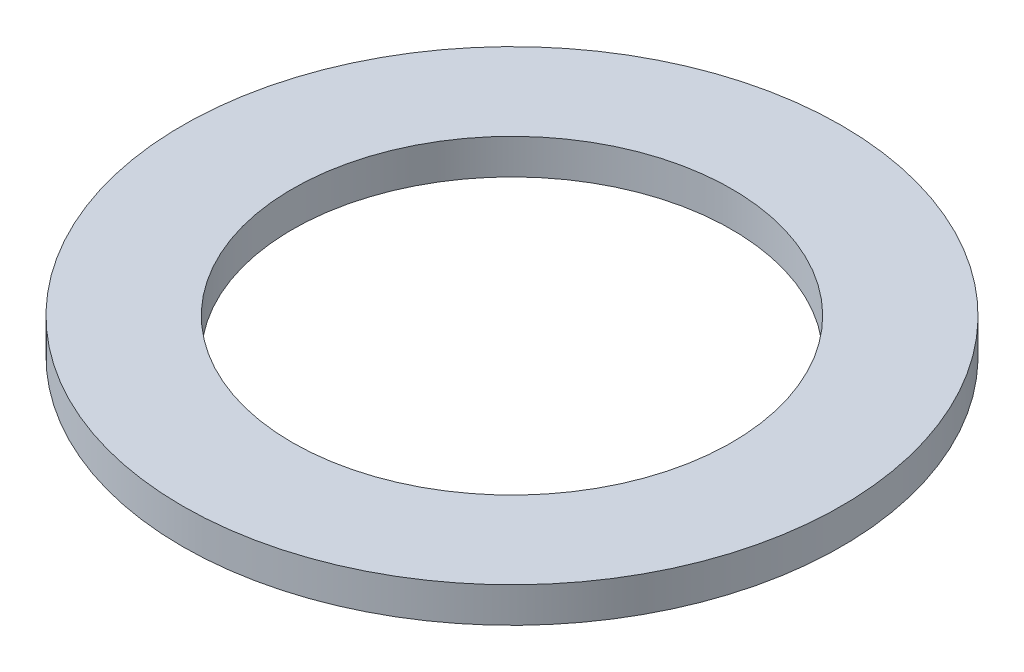
from build123d import *

# Parameters (mm, degrees)
SKETCH1_R           = 75
BOSS_EXTRUDE1_DEPTH = 8
SKETCH2_R           = 50
CUT_EXTRUDE1_DEPTH  = 107.367288205


with BuildPart() as part:
    # Sketch1 → Boss-Extrude1 (new body)
    with BuildSketch(Plane(origin=(0, 0, 0), x_dir=(1, 0, 0), z_dir=(0, 1, 0))):
        Circle(SKETCH1_R)
    extrude(amount=BOSS_EXTRUDE1_DEPTH)

    # Sketch2 → Cut-Extrude1 (cut, through all)
    with BuildSketch(Plane(origin=(0, 0, 0), x_dir=(1, 0, 0), z_dir=(0, 1, 0))):
        Circle(SKETCH2_R)
    extrude(amount=CUT_EXTRUDE1_DEPTH, mode=Mode.SUBTRACT)


solid = part.part
